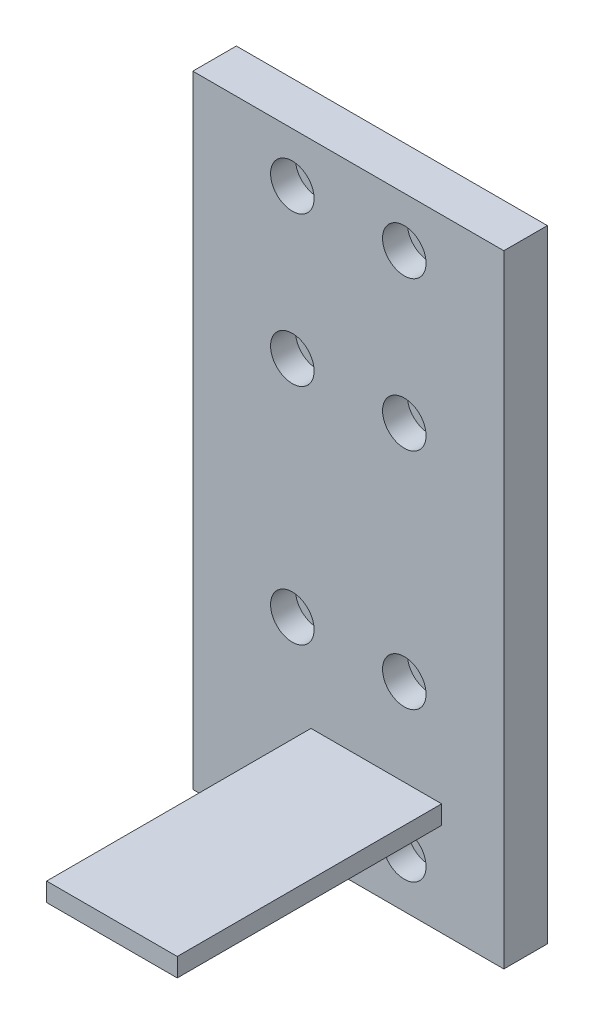
from build123d import *

# Parameters (mm, degrees)
SKETCH1_W           = 50
SKETCH1_H           = 100
BOSS_EXTRUDE1_DEPTH = 7
CUT_EXTRUDE1_REACH  = 58.338
SKETCH2_R           = 1.6
SKETCH3_R           = 3.5
CUT_EXTRUDE2_DEPTH  = 4
SKETCH4_W           = 21
SKETCH4_H           = 3
BOSS_EXTRUDE2_DEPTH = 42.5


with BuildPart() as part:
    # Sketch1 → Boss-Extrude1 (new body)
    with BuildSketch(Plane.XY):
        Rectangle(SKETCH1_W, SKETCH1_H)
    extrude(amount=-BOSS_EXTRUDE1_DEPTH)

    # Sketch2 → Cut-Extrude1 (cut, up to next)
    with BuildSketch(Plane.XY, mode=Mode.PRIVATE) as cut_extrude1_sk1:
        with Locations((-9, 42)):
            Circle(SKETCH2_R)
    cut_extrude1_tool1 = extrude(cut_extrude1_sk1.sketch, amount=-CUT_EXTRUDE1_REACH, mode=Mode.PRIVATE) & part.part
    # Sketch2 → Cut-Extrude1 (cut, up to next)
    with BuildSketch(Plane.XY, mode=Mode.PRIVATE) as cut_extrude1_sk2:
        with Locations((9, 42)):
            Circle(SKETCH2_R)
    cut_extrude1_tool2 = extrude(cut_extrude1_sk2.sketch, amount=-CUT_EXTRUDE1_REACH, mode=Mode.PRIVATE) & part.part
    # Sketch2 → Cut-Extrude1 (cut, up to next)
    with BuildSketch(Plane.XY, mode=Mode.PRIVATE) as cut_extrude1_sk3:
        with Locations((-9, 18)):
            Circle(SKETCH2_R)
    cut_extrude1_tool3 = extrude(cut_extrude1_sk3.sketch, amount=-CUT_EXTRUDE1_REACH, mode=Mode.PRIVATE) & part.part
    # Sketch2 → Cut-Extrude1 (cut, up to next)
    with BuildSketch(Plane.XY, mode=Mode.PRIVATE) as cut_extrude1_sk4:
        with Locations((9, 18)):
            Circle(SKETCH2_R)
    cut_extrude1_tool4 = extrude(cut_extrude1_sk4.sketch, amount=-CUT_EXTRUDE1_REACH, mode=Mode.PRIVATE) & part.part
    # Sketch2 → Cut-Extrude1 (cut, up to next)
    with BuildSketch(Plane.XY, mode=Mode.PRIVATE) as cut_extrude1_sk5:
        with Locations((9, -18)):
            Circle(SKETCH2_R)
    cut_extrude1_tool5 = extrude(cut_extrude1_sk5.sketch, amount=-CUT_EXTRUDE1_REACH, mode=Mode.PRIVATE) & part.part
    # Sketch2 → Cut-Extrude1 (cut, up to next)
    with BuildSketch(Plane.XY, mode=Mode.PRIVATE) as cut_extrude1_sk6:
        with Locations((-9, -18)):
            Circle(SKETCH2_R)
    cut_extrude1_tool6 = extrude(cut_extrude1_sk6.sketch, amount=-CUT_EXTRUDE1_REACH, mode=Mode.PRIVATE) & part.part
    # Sketch2 → Cut-Extrude1 (cut, up to next)
    with BuildSketch(Plane.XY, mode=Mode.PRIVATE) as cut_extrude1_sk7:
        with Locations((-9, -42)):
            Circle(SKETCH2_R)
    cut_extrude1_tool7 = extrude(cut_extrude1_sk7.sketch, amount=-CUT_EXTRUDE1_REACH, mode=Mode.PRIVATE) & part.part
    # Sketch2 → Cut-Extrude1 (cut, up to next)
    with BuildSketch(Plane.XY, mode=Mode.PRIVATE) as cut_extrude1_sk8:
        with Locations((9, -42)):
            Circle(SKETCH2_R)
    cut_extrude1_tool8 = extrude(cut_extrude1_sk8.sketch, amount=-CUT_EXTRUDE1_REACH, mode=Mode.PRIVATE) & part.part
    add(cut_extrude1_tool1.solids().sort_by_distance((-9, 42, 0))[0], mode=Mode.SUBTRACT)
    add(cut_extrude1_tool2.solids().sort_by_distance((9, 42, 0))[0], mode=Mode.SUBTRACT)
    add(cut_extrude1_tool3.solids().sort_by_distance((-9, 18, 0))[0], mode=Mode.SUBTRACT)
    add(cut_extrude1_tool4.solids().sort_by_distance((9, 18, 0))[0], mode=Mode.SUBTRACT)
    add(cut_extrude1_tool5.solids().sort_by_distance((9, -18, 0))[0], mode=Mode.SUBTRACT)
    add(cut_extrude1_tool6.solids().sort_by_distance((-9, -18, 0))[0], mode=Mode.SUBTRACT)
    add(cut_extrude1_tool7.solids().sort_by_distance((-9, -42, 0))[0], mode=Mode.SUBTRACT)
    add(cut_extrude1_tool8.solids().sort_by_distance((9, -42, 0))[0], mode=Mode.SUBTRACT)

    # Sketch3 → Cut-Extrude2 (cut)
    with BuildSketch(Plane.XY):
        with Locations((-9, 42)):
            Circle(SKETCH3_R)
        with Locations((9, 42)):
            Circle(SKETCH3_R)
        with Locations((-9, 18)):
            Circle(SKETCH3_R)
        with Locations((9, 18)):
            Circle(SKETCH3_R)
        with Locations((-9, -18)):
            Circle(SKETCH3_R)
        with Locations((9, -18)):
            Circle(SKETCH3_R)
        with Locations((9, -42)):
            Circle(SKETCH3_R)
        with Locations((-9, -42)):
            Circle(SKETCH3_R)
    extrude(amount=-CUT_EXTRUDE2_DEPTH, mode=Mode.SUBTRACT)

    # Sketch4 → Boss-Extrude2 (add)
    with BuildSketch(Plane.XY):
        with Locations((4.5, -33.5)):
            Rectangle(SKETCH4_W, SKETCH4_H)
    extrude(amount=BOSS_EXTRUDE2_DEPTH)


solid = part.part
